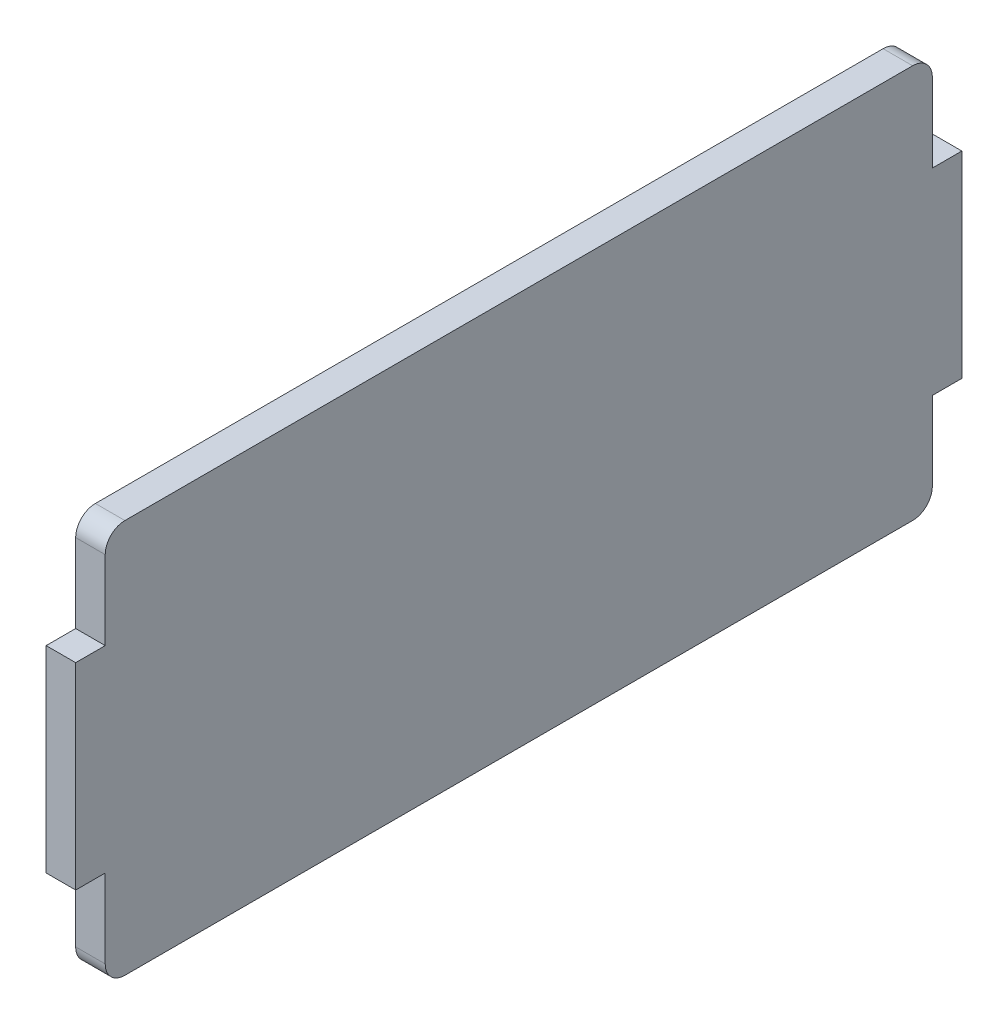
from build123d import *

# Parameters (mm, degrees)
SKETCH1_W           = 3
SKETCH1_H           = 40
EXTRUDE_THIN1_DEPTH = 90
CAVITY1_START       = -65.602294015
CAVITY1_OUTLINE_W   = 3
CAVITY1_OUTLINE_H   = 3
CAVITY1_DEPTH       = 10
CAVITY1_START_2     = -35.602294015
CAVITY1_2_OUTLINE_W = 3
CAVITY1_2_OUTLINE_H = 3
CAVITY1_2_DEPTH     = 10
FILLET1_R           = 2


# Read off the part's stored shape, not the designer's step: Cavity1
with BuildPart() as part:
    # Sketch1 → Extrude-Thin1 (new body)
    with BuildSketch(Plane.XY.offset(1.5)):
        with Locations((84.585106383, -45.602294015)):
            Rectangle(SKETCH1_W, SKETCH1_H)
    extrude(amount=-EXTRUDE_THIN1_DEPTH)

    # Cavity1 outline → Cavity1 (cut)
    with BuildSketch(Plane(origin=(0, 0, 0), x_dir=(1, 0, 0), z_dir=(0, 1, 0)).offset(CAVITY1_START)):
        with Locations((84.585106383, 87)):
            Rectangle(CAVITY1_OUTLINE_W, CAVITY1_OUTLINE_H)
        with Locations((84.585106383, 0)):
            Rectangle(CAVITY1_OUTLINE_W, CAVITY1_OUTLINE_H)
    extrude(amount=CAVITY1_DEPTH, mode=Mode.SUBTRACT)

    # Cavity1 2 outline → Cavity1 2 (cut)
    with BuildSketch(Plane(origin=(0, 0, 0), x_dir=(1, 0, 0), z_dir=(0, 1, 0)).offset(CAVITY1_START_2)):
        with Locations((84.585106383, 87)):
            Rectangle(CAVITY1_2_OUTLINE_W, CAVITY1_2_OUTLINE_H)
        with Locations((84.585106383, 0)):
            Rectangle(CAVITY1_2_OUTLINE_W, CAVITY1_2_OUTLINE_H)
    extrude(amount=CAVITY1_2_DEPTH, mode=Mode.SUBTRACT)

    # Fillet1
    fillet1_edges = [part.edges().sort_by_distance(p)[0] for p in [
        (84.585106383, -65.602294015, -85.5),
        (84.585106383, -25.602294015, -85.5),
        (84.585106383, -65.602294015, -1.5),
        (84.585106383, -25.602294015, -1.5),
    ]]
    fillet(fillet1_edges, radius=FILLET1_R)


solid = part.part
